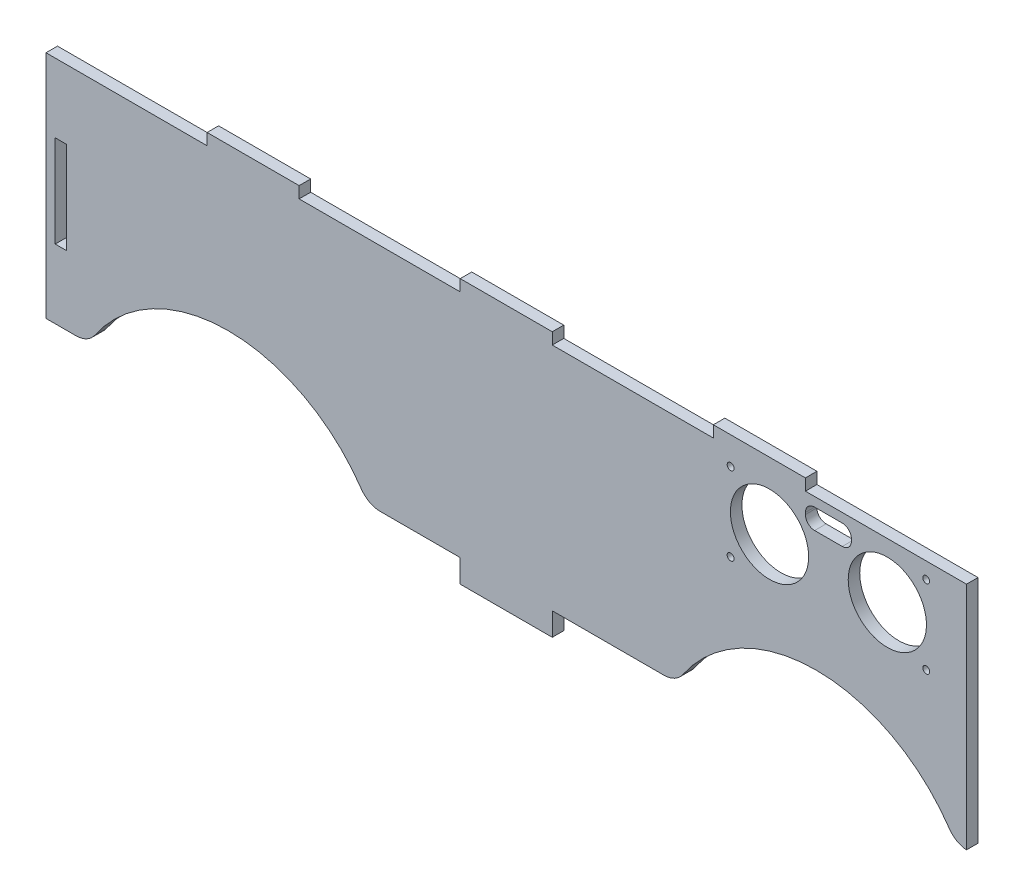
from build123d import *

# Parameters (mm, degrees)
SKETCH1_R           = 8.5
SKETCH1_R_2         = 0.75
SKETCH1_W           = 2.5
SKETCH1_H           = 20
BOSS_EXTRUDE1_DEPTH = 1.25
FILLET2_R           = 5


with BuildPart() as part:
    # Sketch1 → Boss-Extrude1 (new, symmetric)
    with BuildSketch(Plane.XY):
        with BuildLine():
            Line((-100, -25), (-100, 25))
            Line((-100, 25), (-65, 25))
            Line((-65, 25), (-65, 27.5))
            Line((-65, 27.5), (-45, 27.5))
            Line((-45, 27.5), (-45, 25))
            Line((-45, 25), (-10, 25))
            Line((-10, 25), (-10, 27.5))
            Line((-10, 27.5), (10, 27.5))
            Line((10, 27.5), (10, 25))
            Line((10, 25), (45, 25))
            Line((45, 25), (45, 27.5))
            Line((45, 27.5), (65, 27.5))
            Line((65, 27.5), (65, 25))
            Line((65, 25), (100, 25))
            Line((100, 25), (100, -25))
            Line((100, -25), (97.62, -25))
            ThreePointArc((97.62, -25), (67.309110868, -7.5), (36.998221735, -25))
            Line((36.998221735, -25), (10, -25))
            Line((10, -25), (10, -30))
            Line((10, -30), (-10, -30))
            Line((-10, -30), (-10, -25))
            Line((-10, -25), (-30.118221735, -25))
            ThreePointArc((-30.118221735, -25), (-60.429110868, -7.5), (-90.74, -25))
            Line((-90.74, -25), (-100, -25))
        make_face()
        with Locations((57.2, 13)):
            Circle(SKETCH1_R, mode=Mode.SUBTRACT)
        with Locations((48.75, 4.5)):
            Circle(SKETCH1_R_2, mode=Mode.SUBTRACT)
        with Locations(Location((91.25, 4.5, 0), (0, 0, 180))):
            Circle(SKETCH1_R_2, mode=Mode.SUBTRACT)
        with Locations(Location((82.8, 13, 0), (0, 0, 180))):
            Circle(SKETCH1_R, mode=Mode.SUBTRACT)
        with Locations((91.25, 21.5)):
            Circle(SKETCH1_R_2, mode=Mode.SUBTRACT)
        with Locations(Location((48.75, 21.5, 0), (0, 0, 180))):
            Circle(SKETCH1_R_2, mode=Mode.SUBTRACT)
        with Locations((-96.75, 0)):
            Rectangle(SKETCH1_W, SKETCH1_H, mode=Mode.SUBTRACT)
        with BuildLine():
            Line((67, 18.6), (73, 18.6))
            ThreePointArc((73, 18.6), (74.414213562, 19.185786438), (75, 20.6))
            Line((75, 20.6), (75, 21))
            ThreePointArc((75, 21), (74.414213562, 22.414213562), (73, 23))
            Line((73, 23), (67, 23))
            ThreePointArc((67, 23), (65.585786438, 22.414213562), (65, 21))
            Line((65, 21), (65, 20.6))
            ThreePointArc((65, 20.6), (65.585786438, 19.185786438), (67, 18.6))
        make_face(mode=Mode.SUBTRACT)
    extrude(amount=BOSS_EXTRUDE1_DEPTH, both=True)

    # Fillet2
    # the kernel refuses this fillet: 5 mm, written as the material it takes off along each edge
    with BuildSketch(Plane(origin=(97.62, -25, 7.66613531), x_dir=(-0.5314154668172085, 0.8471113277648036, 0), z_dir=(0, 0, -1))) as fillet2_piece_1:
        with BuildLine():
            CenterArc((2.749772276, 4.996638315), FILLET2_R, 216.591278999, 51.307578807)
            Line((-1.264768811, 2.01612496), (-1.345059633, 1.956514693))
            ThreePointArc((-1.345059633, 1.956514693), (-0.717095538, 0.954920933), (-0.084711133, -0.053141547))
            Line((-0.084711133, -0.053141547), (0.003666363, -0.099932766))
            ThreePointArc((0.003666363, -0.099932766), (1.283227062, -0.076468208), (2.562787761, -0.099932766))
            Line((2.562787761, -0.099932766), (2.566454124, 0))
        make_face()
    extrude(amount=15.332270621, mode=Mode.SUBTRACT)
    with BuildSketch(Plane(origin=(36.998221735, -25, 8.15250564), x_dir=(-1, 0, 0), z_dir=(0, 0, -1)), Plane(origin=(-30.118221735, -25, -8.15250564), x_dir=(1, 0, 0), z_dir=(0, 0, 1))) as fillet2_piece_2:
        with BuildLine():
            CenterArc((2.761002256, 5), FILLET2_R, 214.228866328, 55.771133672)
            Line((-1.372984168, 2.1875), (-1.455663896, 2.13125))
            ThreePointArc((-1.455663896, 2.13125), (-0.751006819, 1.053257332), (-0.08660254, -0.05))
            Line((-0.08660254, -0.05), (0, -0.1))
            Line((0, -0.1), (2.761002256, -0.1))
            Line((2.761002256, -0.1), (2.761002256, 0))
        make_face()
    extrude(amount=16.305011279, mode=Mode.SUBTRACT)
    with BuildSketch(Plane(origin=(-90.74, -25, -8.15250564), x_dir=(-1, 0, 0), z_dir=(0, 0, 1))) as fillet2_piece_3:
        with BuildLine():
            CenterArc((2.761002256, -5), FILLET2_R, 90, 55.771133672)
            Line((-1.372984168, -2.1875), (-1.455663896, -2.13125))
            ThreePointArc((-1.455663896, -2.13125), (-0.751006819, -1.053257332), (-0.08660254, 0.05))
            Line((-0.08660254, 0.05), (0, 0.1))
            Line((0, 0.1), (2.761002256, 0.1))
            Line((2.761002256, 0.1), (2.761002256, 0))
        make_face()
    extrude(amount=16.305011279, mode=Mode.SUBTRACT)


solid = part.part
